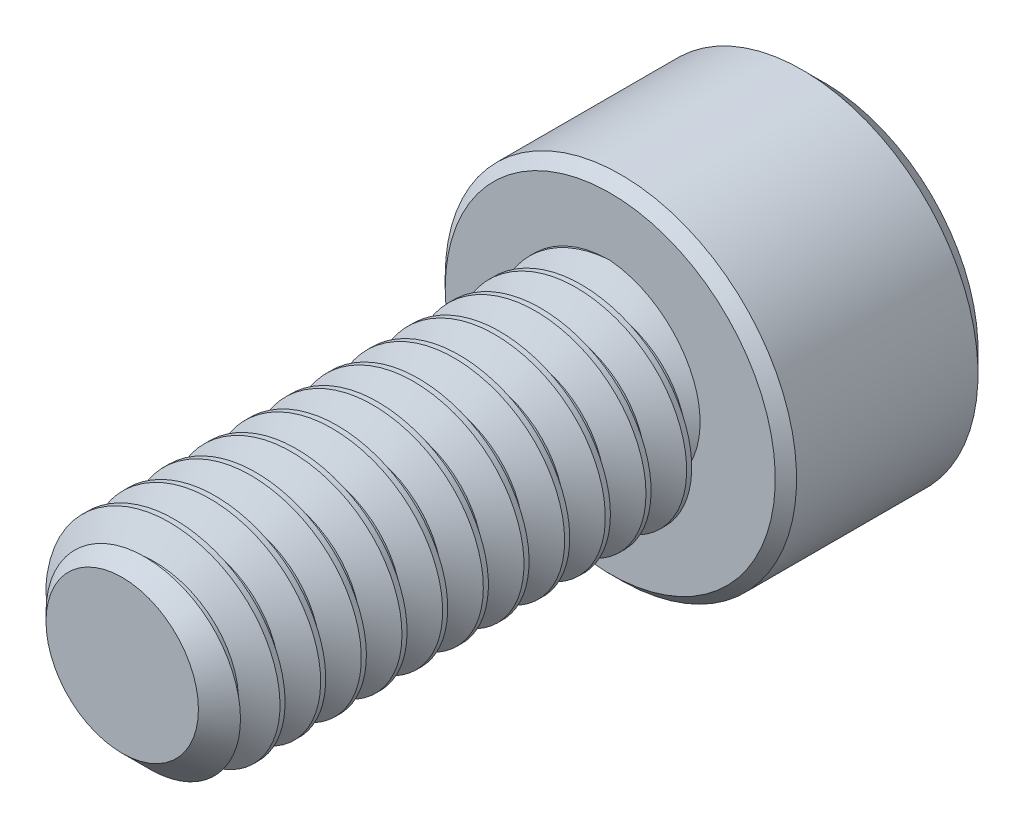
from build123d import *

# Parameters (mm, degrees)
SKETCH1_R          = 2.0828
EXTRUDE1_DEPTH     = 9.525
CHAMFER3_SIZE      = 0.5953125
CUT_SWEEP1_PITCH   = 0.79375
SKETCH6_R          = 3.429
EXTRUDE2_DEPTH     = 4.1656
CUT_EXTRUDE1_DEPTH = 2.67890625
SKETCH8_R          = 2.062222993
CUT_EXTRUDE2_DEPTH = 0.41656
CUT_EXTRUDE2_DRAFT = -45
CHAMFER1_SIZE      = 0.41656
CHAMFER2_SIZE      = 0.20828


with BuildPart() as part:
    # Sketch1 → Extrude1 (new body)
    with BuildSketch(Plane.XY):
        Circle(SKETCH1_R)
    extrude(amount=-EXTRUDE1_DEPTH)

    # Chamfer3
    chamfer3_edges = [part.edges().sort_by_distance(p)[0] for p in [
        (-2.0828, 0, 0),
    ]]
    chamfer(chamfer3_edges, length=CHAMFER3_SIZE)

    # Cut-Sweep1: the profile of Sketch3 profile screwed along a right-hand helix of 13 turns, 6 arcs to a turn; built about Z, then put on its axis
    cut_sweep1_z = Axis((0, 0, 0), (0, 0, 1))
    cut_sweep1_corners = [(2.0831, 0, -0.694704455), (1.567244252, 0, -0.396875), (1.567244252, 0, -0.29765625), (2.0831, 0, 0.000173205)]
    with BuildLine(mode=Mode.PRIVATE) as cut_sweep1_profile:
        Line(cut_sweep1_corners[0], cut_sweep1_corners[1])
        Line(cut_sweep1_corners[1], cut_sweep1_corners[2])
        Line(cut_sweep1_corners[2], cut_sweep1_corners[3])
        Line(cut_sweep1_corners[3], cut_sweep1_corners[0])
    cut_sweep1_cap = Face(cut_sweep1_profile.wire())
    cut_sweep1_turn_angles = [0, 30, 60, 90, 120, 150, 180, 210, 240, 270, 300, 330, 360]
    cut_sweep1_turn_weights = [1, 0.8660254037844387, 1, 0.8660254037844387, 1, 0.8660254037844387, 1, 0.8660254037844387, 1, 0.8660254037844387, 1, 0.8660254037844387, 1]
    cut_sweep1_turn_rails = [Edge.make_bspline([Vector(p[0], p[1], 0).rotate(cut_sweep1_z, cut_sweep1_turn_angles[k]) / cut_sweep1_turn_weights[k] + Vector(0, 0, p[2] + CUT_SWEEP1_PITCH * cut_sweep1_turn_angles[k] / 360) for k in range(13)], [0, 0, 0, 1, 1, 2, 2, 3, 3, 4, 4, 5, 5, 6, 6, 6], 2, cut_sweep1_turn_weights) for p in cut_sweep1_corners]
    cut_sweep1_turn_sides = [Face.make_surface_from_curves(cut_sweep1_turn_rails[p[0]], cut_sweep1_turn_rails[p[1]]) for p in [(0, 1), (1, 2), (2, 3), (3, 0)]]
    cut_sweep1 = Plane(origin=(0, 0, 0), x_dir=(0, 1, 0), z_dir=(0, 0, -1)) * Solid(Shell([*[p.moved(Location((0, 0, CUT_SWEEP1_PITCH * i))) for i in range(13) for p in cut_sweep1_turn_sides], cut_sweep1_cap, cut_sweep1_cap.rotate(cut_sweep1_z, 4680).moved(Location((0, 0, CUT_SWEEP1_PITCH * 4680 / 360)))]))
    add(cut_sweep1, mode=Mode.SUBTRACT)

    # Sketch6 → Extrude2 (add)
    with BuildSketch(Plane(origin=(0, 0, -9.525), x_dir=(-1, 0, 0), z_dir=(0, 0, -1))):
        Circle(SKETCH6_R)
    extrude(amount=EXTRUDE2_DEPTH)

    # Sketch7 → Cut-Extrude1 (cut)
    with BuildSketch(Plane(origin=(0, 0, -13.6906), x_dir=(-1, 0, 0), z_dir=(0, 0, -1))):
        Polygon((0, 2.062222993), (-1.7859375, 1.031111496), (-1.7859375, -1.031111496), (0, -2.062222993), (1.7859375, -1.031111496), (1.7859375, 1.031111496), align=None)
    extrude(amount=-CUT_EXTRUDE1_DEPTH, mode=Mode.SUBTRACT)


with BuildPart() as cut_extrude2_tool:
    # Sketch8 → Cut-Extrude2 (with draft: the straight prism first)
    with BuildSketch(Plane(origin=(0, 0, -13.6906), x_dir=(-1, 0, 0), z_dir=(0, 0, -1))):
        Circle(SKETCH8_R)
    extrude(amount=-CUT_EXTRUDE2_DEPTH)
    # Cut-Extrude2: the draft: its side faces are tilted about the plane it starts from
    cut_extrude2_sides = [cut_extrude2_tool.faces().sort_by_distance(p)[0] for p in [
        (2.062222993, 0, -13.48232),
    ]]
    draft(cut_extrude2_sides, Plane(origin=(0, 0, -13.6906), x_dir=(-1, 0, 0), z_dir=(0, 0, -1)), CUT_EXTRUDE2_DRAFT)


with BuildPart() as part_1:
    add(part.part)

    # Cut-Extrude2: cut by cut_extrude2_tool
    add(cut_extrude2_tool.part, mode=Mode.SUBTRACT)

    # Chamfer1
    chamfer1_edges = [part_1.edges().sort_by_distance(p)[0] for p in [
        (3.429, 0, -13.6906),
    ]]
    chamfer(chamfer1_edges, length=CHAMFER1_SIZE)

    # Chamfer2
    chamfer2_edges = [part_1.edges().sort_by_distance(p)[0] for p in [
        (3.429, 0, -9.525),
    ]]
    chamfer(chamfer2_edges, length=CHAMFER2_SIZE)


solid = part_1.part
